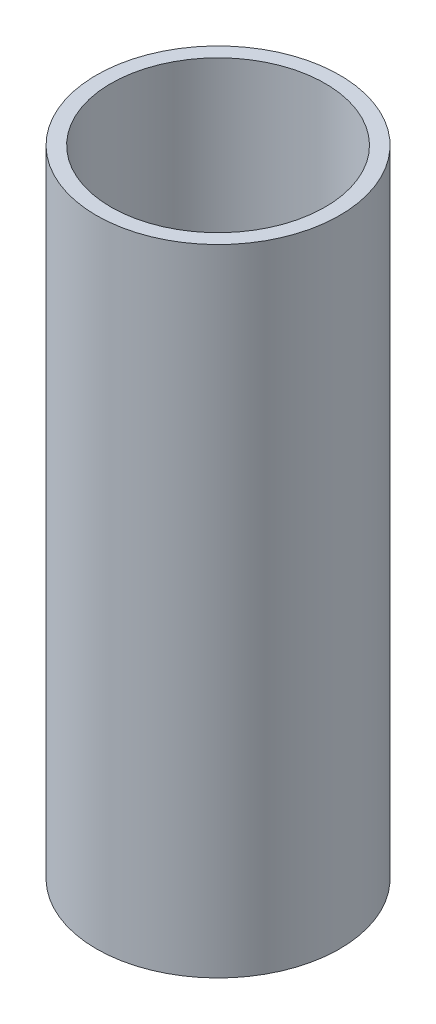
from build123d import *

# Parameters (mm, degrees)
SKETCH1_R           = 57.5
BOSS_EXTRUDE1_DEPTH = 300.241473824
SKETCH2_R           = 50.630118882
CUT_EXTRUDE1_DEPTH  = 312.058583878


with BuildPart() as part:
    # Sketch1 → Boss-Extrude1 (new body)
    with BuildSketch(Plane(origin=(0, 0, 0), x_dir=(1, 0, 0), z_dir=(0, 1, 0))):
        Circle(SKETCH1_R)
    extrude(amount=BOSS_EXTRUDE1_DEPTH)

    # Sketch2 → Cut-Extrude1 (cut, through all)
    with BuildSketch(Plane(origin=(0, 0, 0), x_dir=(1, 0, 0), z_dir=(0, 1, 0))):
        Circle(SKETCH2_R)
    extrude(amount=CUT_EXTRUDE1_DEPTH, mode=Mode.SUBTRACT)


solid = part.part
